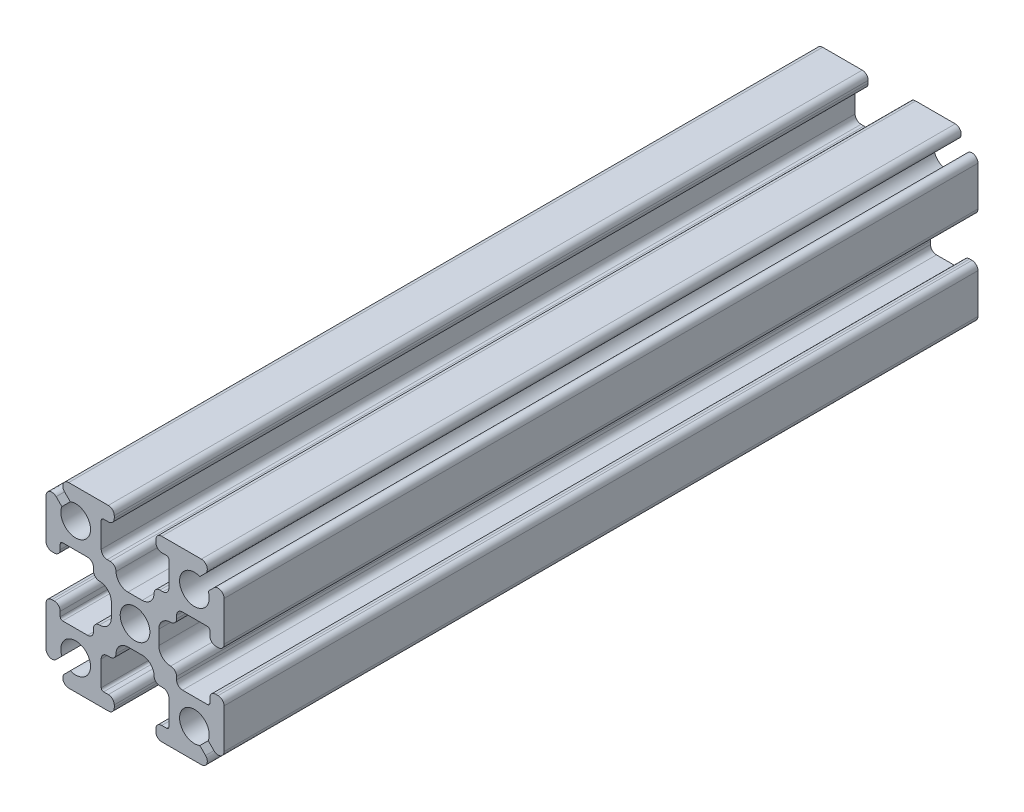
from build123d import *

# Parameters (mm, degrees)
SKETCH1_R           = 1.25
BOSS_EXTRUDE1_DEPTH = 63.5


with BuildPart() as part:
    # Sketch1 → Boss-Extrude1 (new body)
    with BuildSketch(Plane.XY):
        with BuildLine():
            Line((6.646446609, 5.939339828), (6.163645978, 5.456539197))
            ThreePointArc((6.163645978, 5.456539197), (4.116116524, 4.116116524), (5.456539197, 6.163645978))
            Line((5.456539197, 6.163645978), (5.939339828, 6.646446609))
            ThreePointArc((5.939339828, 6.646446609), (6.047726204, 7.191341716), (5.585786438, 7.5))
            Line((5.585786438, 7.5), (2.25, 7.5))
            ThreePointArc((2.25, 7.5), (1.896446609, 7.353553391), (1.75, 7))
            Line((1.75, 7), (1.75, 6.8))
            ThreePointArc((1.75, 6.8), (1.896446609, 6.446446609), (2.25, 6.3))
            Line((2.25, 6.3), (2.65, 6.3))
            ThreePointArc((2.65, 6.3), (2.791421356, 6.241421356), (2.85, 6.1))
            Line((2.85, 6.1), (2.85, 4))
            ThreePointArc((2.85, 4), (2.703553391, 3.646446609), (2.35, 3.5))
            Line((2.35, 3.5), (2.1, 3.5))
            ThreePointArc((2.1, 3.5), (1.746446609, 3.353553391), (1.6, 3))
            ThreePointArc((1.6, 3), (1.307106781, 2.292893219), (0.6, 2))
            Line((0.6, 2), (-0.6, 2))
            ThreePointArc((-0.6, 2), (-1.307106781, 2.292893219), (-1.6, 3))
            ThreePointArc((-1.6, 3), (-1.746446609, 3.353553391), (-2.1, 3.5))
            Line((-2.1, 3.5), (-2.35, 3.5))
            ThreePointArc((-2.35, 3.5), (-2.703553391, 3.646446609), (-2.85, 4))
            Line((-2.85, 4), (-2.85, 6.1))
            ThreePointArc((-2.85, 6.1), (-2.791421356, 6.241421356), (-2.65, 6.3))
            Line((-2.65, 6.3), (-2.25, 6.3))
            ThreePointArc((-2.25, 6.3), (-1.896446609, 6.446446609), (-1.75, 6.8))
            Line((-1.75, 6.8), (-1.75, 7))
            ThreePointArc((-1.75, 7), (-1.896446609, 7.353553391), (-2.25, 7.5))
            Line((-2.25, 7.5), (-5.585786438, 7.5))
            ThreePointArc((-5.585786438, 7.5), (-6.047726204, 7.191341716), (-5.939339828, 6.646446609))
            Line((-5.939339828, 6.646446609), (-5.456539197, 6.163645978))
            ThreePointArc((-5.456539197, 6.163645978), (-4.116116524, 4.116116524), (-6.163645978, 5.456539197))
            Line((-6.163645978, 5.456539197), (-6.646446609, 5.939339828))
            ThreePointArc((-6.646446609, 5.939339828), (-7.191341716, 6.047726204), (-7.5, 5.585786438))
            Line((-7.5, 5.585786438), (-7.5, 2.25))
            ThreePointArc((-7.5, 2.25), (-7.353553391, 1.896446609), (-7, 1.75))
            Line((-7, 1.75), (-6.8, 1.75))
            ThreePointArc((-6.8, 1.75), (-6.446446609, 1.896446609), (-6.3, 2.25))
            Line((-6.3, 2.25), (-6.3, 2.65))
            ThreePointArc((-6.3, 2.65), (-6.241421356, 2.791421356), (-6.1, 2.85))
            Line((-6.1, 2.85), (-4, 2.85))
            ThreePointArc((-4, 2.85), (-3.646446609, 2.703553391), (-3.5, 2.35))
            Line((-3.5, 2.35), (-3.5, 2.1))
            ThreePointArc((-3.5, 2.1), (-3.353553391, 1.746446609), (-3, 1.6))
            ThreePointArc((-3, 1.6), (-2.292893219, 1.307106781), (-2, 0.6))
            Line((-2, 0.6), (-2, -0.6))
            ThreePointArc((-2, -0.6), (-2.292893219, -1.307106781), (-3, -1.6))
            ThreePointArc((-3, -1.6), (-3.353553391, -1.746446609), (-3.5, -2.1))
            Line((-3.5, -2.1), (-3.5, -2.35))
            ThreePointArc((-3.5, -2.35), (-3.646446609, -2.703553391), (-4, -2.85))
            Line((-4, -2.85), (-6.1, -2.85))
            ThreePointArc((-6.1, -2.85), (-6.241421356, -2.791421356), (-6.3, -2.65))
            Line((-6.3, -2.65), (-6.3, -2.25))
            ThreePointArc((-6.3, -2.25), (-6.446446609, -1.896446609), (-6.8, -1.75))
            Line((-6.8, -1.75), (-7, -1.75))
            ThreePointArc((-7, -1.75), (-7.353553391, -1.896446609), (-7.5, -2.25))
            Line((-7.5, -2.25), (-7.5, -5.585786438))
            ThreePointArc((-7.5, -5.585786438), (-7.191341716, -6.047726204), (-6.646446609, -5.939339828))
            Line((-6.646446609, -5.939339828), (-6.163645978, -5.456539197))
            ThreePointArc((-6.163645978, -5.456539197), (-4.116116524, -4.116116524), (-5.456539197, -6.163645978))
            Line((-5.456539197, -6.163645978), (-5.939339828, -6.646446609))
            ThreePointArc((-5.939339828, -6.646446609), (-6.047726204, -7.191341716), (-5.585786438, -7.5))
            Line((-5.585786438, -7.5), (-2.25, -7.5))
            ThreePointArc((-2.25, -7.5), (-1.896446609, -7.353553391), (-1.75, -7))
            Line((-1.75, -7), (-1.75, -6.8))
            ThreePointArc((-1.75, -6.8), (-1.896446609, -6.446446609), (-2.25, -6.3))
            Line((-2.25, -6.3), (-2.65, -6.3))
            ThreePointArc((-2.65, -6.3), (-2.791421356, -6.241421356), (-2.85, -6.1))
            Line((-2.85, -6.1), (-2.85, -4))
            ThreePointArc((-2.85, -4), (-2.703553391, -3.646446609), (-2.35, -3.5))
            Line((-2.35, -3.5), (-2.1, -3.5))
            ThreePointArc((-2.1, -3.5), (-1.746446609, -3.353553391), (-1.6, -3))
            ThreePointArc((-1.6, -3), (-1.307106781, -2.292893219), (-0.6, -2))
            Line((-0.6, -2), (0.6, -2))
            ThreePointArc((0.6, -2), (1.307106781, -2.292893219), (1.6, -3))
            ThreePointArc((1.6, -3), (1.746446609, -3.353553391), (2.1, -3.5))
            Line((2.1, -3.5), (2.35, -3.5))
            ThreePointArc((2.35, -3.5), (2.703553391, -3.646446609), (2.85, -4))
            Line((2.85, -4), (2.85, -6.1))
            ThreePointArc((2.85, -6.1), (2.791421356, -6.241421356), (2.65, -6.3))
            Line((2.65, -6.3), (2.25, -6.3))
            ThreePointArc((2.25, -6.3), (1.896446609, -6.446446609), (1.75, -6.8))
            Line((1.75, -6.8), (1.75, -7))
            ThreePointArc((1.75, -7), (1.896446609, -7.353553391), (2.25, -7.5))
            Line((2.25, -7.5), (5.585786438, -7.5))
            ThreePointArc((5.585786438, -7.5), (6.047726204, -7.191341716), (5.939339828, -6.646446609))
            Line((5.939339828, -6.646446609), (5.456539197, -6.163645978))
            ThreePointArc((5.456539197, -6.163645978), (4.116116524, -4.116116524), (6.163645978, -5.456539197))
            Line((6.163645978, -5.456539197), (6.646446609, -5.939339828))
            ThreePointArc((6.646446609, -5.939339828), (7.191341716, -6.047726204), (7.5, -5.585786438))
            Line((7.5, -5.585786438), (7.5, -2.25))
            ThreePointArc((7.5, -2.25), (7.353553391, -1.896446609), (7, -1.75))
            Line((7, -1.75), (6.8, -1.75))
            ThreePointArc((6.8, -1.75), (6.446446609, -1.896446609), (6.3, -2.25))
            Line((6.3, -2.25), (6.3, -2.65))
            ThreePointArc((6.3, -2.65), (6.241421356, -2.791421356), (6.1, -2.85))
            Line((6.1, -2.85), (4, -2.85))
            ThreePointArc((4, -2.85), (3.646446609, -2.703553391), (3.5, -2.35))
            Line((3.5, -2.35), (3.5, -2.1))
            ThreePointArc((3.5, -2.1), (3.353553391, -1.746446609), (3, -1.6))
            ThreePointArc((3, -1.6), (2.292893219, -1.307106781), (2, -0.6))
            Line((2, -0.6), (2, 0.6))
            ThreePointArc((2, 0.6), (2.292893219, 1.307106781), (3, 1.6))
            ThreePointArc((3, 1.6), (3.353553391, 1.746446609), (3.5, 2.1))
            Line((3.5, 2.1), (3.5, 2.35))
            ThreePointArc((3.5, 2.35), (3.646446609, 2.703553391), (4, 2.85))
            Line((4, 2.85), (6.1, 2.85))
            ThreePointArc((6.1, 2.85), (6.241421356, 2.791421356), (6.3, 2.65))
            Line((6.3, 2.65), (6.3, 2.25))
            ThreePointArc((6.3, 2.25), (6.446446609, 1.896446609), (6.8, 1.75))
            Line((6.8, 1.75), (7, 1.75))
            ThreePointArc((7, 1.75), (7.353553391, 1.896446609), (7.5, 2.25))
            Line((7.5, 2.25), (7.5, 5.585786438))
            ThreePointArc((7.5, 5.585786438), (7.191341716, 6.047726204), (6.646446609, 5.939339828))
        make_face()
        Circle(SKETCH1_R, mode=Mode.SUBTRACT)
    extrude(amount=BOSS_EXTRUDE1_DEPTH)


solid = part.part
